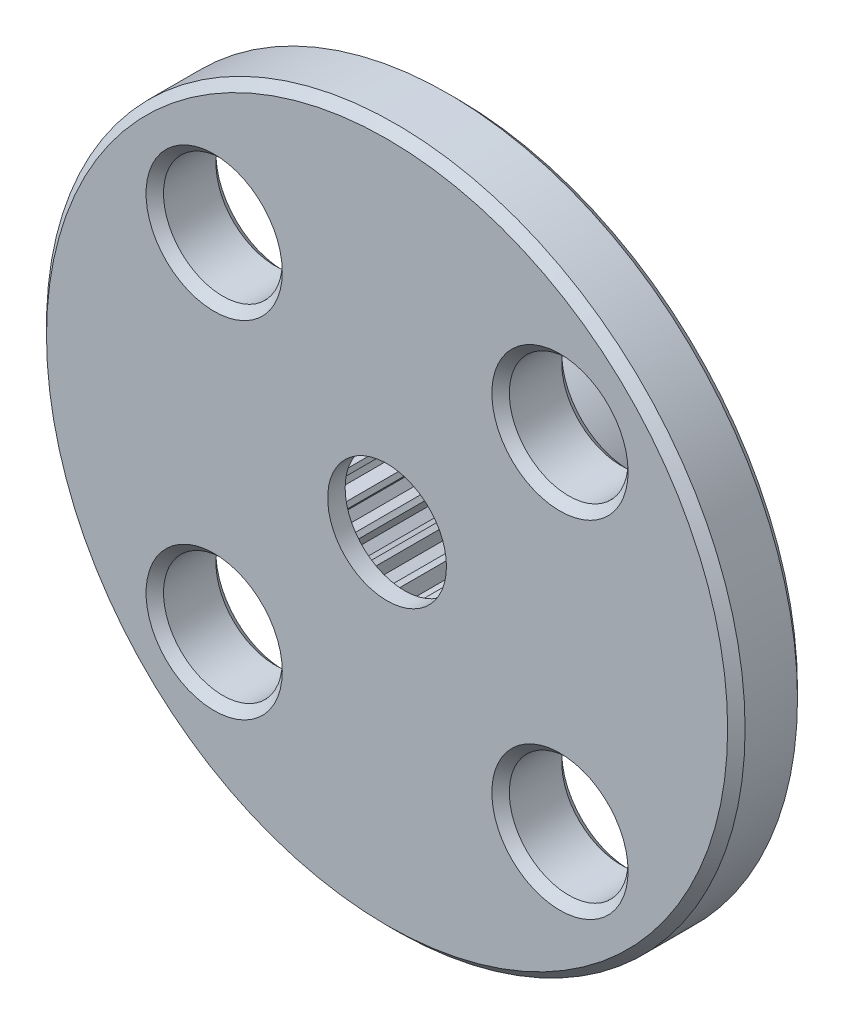
from build123d import *

# Parameters (mm, degrees)
CUT_EXTRUDE1_START             = -4
CUT_EXTRUDE1_OUTLINE_R         = 10
CUT_EXTRUDE1_DEPTH             = 2
CUT_EXTRUDE1_START_2           = -2
CUT_EXTRUDE1_2_OUTLINE_R       = 4.5
CUT_EXTRUDE1_2_DEPTH           = 2.5
CUT_EXTRUDE1_3_DEPTH           = 0.5
CUT_EXTRUDE1_START_3           = 0.42219887
CUT_EXTRUDE1_4_DEPTH           = 0.07780113
F_3_4_3_4_DIAMETER_HOLE1_D     = 3.4
F_3_4_3_4_DIAMETER_HOLE1_DEPTH = 4.5
F_3_4_3_4_DIAMETER_HOLE2_D     = 3.4
CHAMFER1_SIZE                  = 0.25


with BuildPart() as part:
    # Cut-Extrude1: read off the stored shape, not the designer's step
    # Cut-Extrude1 outline → Cut-Extrude1 (new body)
    with BuildSketch(Plane(origin=(0, 0, -2), x_dir=(-1, 0, 0), z_dir=(0, 0, -1)).offset(CUT_EXTRUDE1_START)):
        Circle(CUT_EXTRUDE1_OUTLINE_R)
        with BuildLine():
            Line((-2.618580344, -1.504944317), (-2.318244763, -1.172831706))
            ThreePointArc((-2.318244763, -1.172831706), (-2.350773593, -1.106190086), (-2.381387187, -1.038647225))
            Line((-2.381387187, -1.038647225), (-2.828725458, -1.058363222))
            Line((-2.828725458, -1.058363222), (-2.91057726, -0.806449273))
            Line((-2.91057726, -0.806449273), (-2.537084225, -0.559461013))
            ThreePointArc((-2.537084225, -0.559461013), (-2.552018005, -0.486823471), (-2.56487259, -0.413789301))
            Line((-2.56487259, -0.413789301), (-3.003060075, -0.32163738))
            Line((-3.003060075, -0.32163738), (-3.019691902, -0.057282056))
            Line((-3.019691902, -0.057282056), (-2.596509355, 0.089062673))
            ThreePointArc((-2.596509355, 0.089062673), (-2.592909741, 0.163132053), (-2.587197616, 0.237068526))
            Line((-2.587197616, 0.237068526), (-2.988701384, 0.435298121))
            Line((-2.988701384, 0.435298121), (-2.939068196, 0.695484403))
            Line((-2.939068196, 0.695484403), (-2.492786253, 0.731990224))
            ThreePointArc((-2.492786253, 0.731990224), (-2.470879421, 0.802837391), (-2.446959501, 0.873030465))
            Line((-2.446959501, 0.873030465), (-2.786551594, 1.16488224))
            Line((-2.786551594, 1.16488224), (-2.673772027, 1.40455102))
            Line((-2.673772027, 1.40455102), (-2.232432223, 1.328924137))
            ThreePointArc((-2.232432223, 1.328924137), (-2.19359466, 1.392097502), (-2.15296992, 1.45413669))
            Line((-2.15296992, 1.45413669), (-2.409312519, 1.821272524))
            Line((-2.409312519, 1.821272524), (-2.240472927, 2.02536453))
            Line((-2.240472927, 2.02536453), (-1.831806265, 1.842356859))
            ThreePointArc((-1.831806265, 1.842356859), (-1.77847828, 1.893887008), (-1.723701322, 1.943874158))
            Line((-1.723701322, 1.943874158), (-1.880687477, 2.363225557))
            Line((-1.880687477, 2.363225557), (-1.666396674, 2.518916939))
            Line((-1.666396674, 2.518916939), (-1.316081184, 2.240027524))
            ThreePointArc((-1.316081184, 2.240027524), (-1.251613568, 2.276676628), (-1.18612623, 2.311470864))
            Line((-1.18612623, 2.311470864), (-1.233891925, 2.756688437))
            Line((-1.233891925, 2.756688437), (-0.987614589, 2.854196532))
            Line((-0.987614589, 2.854196532), (-0.717661881, 2.496949021))
            ThreePointArc((-0.717661881, 2.496949021), (-0.646105372, 2.516414282), (-0.574022465, 2.533829355))
            Line((-0.574022465, 2.533829355), (-0.509566405, 2.976938444))
            Line((-0.509566405, 2.976938444), (-0.246777047, 3.01013646))
            Line((-0.246777047, 3.01013646), (-0.074149243, 2.596978029))
            ThreePointArc((-0.074149243, 2.596978029), (0, 2.598036372), (0.074149243, 2.596978029))
            Line((0.074149243, 2.596978029), (0.246777047, 3.01013646))
            Line((0.246777047, 3.01013646), (0.509566405, 2.976938444))
            Line((0.509566405, 2.976938444), (0.574022465, 2.533829355))
            ThreePointArc((0.574022465, 2.533829355), (0.646105372, 2.516414282), (0.717661881, 2.496949021))
            Line((0.717661881, 2.496949021), (0.987614589, 2.854196532))
            Line((0.987614589, 2.854196532), (1.233891925, 2.756688437))
            Line((1.233891925, 2.756688437), (1.18612623, 2.311470864))
            ThreePointArc((1.18612623, 2.311470864), (1.251613568, 2.276676628), (1.316081184, 2.240027524))
            Line((1.316081184, 2.240027524), (1.666396674, 2.518916939))
            Line((1.666396674, 2.518916939), (1.880687477, 2.363225557))
            Line((1.880687477, 2.363225557), (1.723701322, 1.943874158))
            ThreePointArc((1.723701322, 1.943874158), (1.77847828, 1.893887008), (1.831806265, 1.842356859))
            Line((1.831806265, 1.842356859), (2.240472927, 2.02536453))
            Line((2.240472927, 2.02536453), (2.409312519, 1.821272524))
            Line((2.409312519, 1.821272524), (2.15296992, 1.45413669))
            ThreePointArc((2.15296992, 1.45413669), (2.19359466, 1.392097502), (2.232432223, 1.328924137))
            Line((2.232432223, 1.328924137), (2.673772027, 1.40455102))
            Line((2.673772027, 1.40455102), (2.786551594, 1.16488224))
            Line((2.786551594, 1.16488224), (2.446959501, 0.873030465))
            ThreePointArc((2.446959501, 0.873030465), (2.470879421, 0.802837391), (2.492786253, 0.731990224))
            Line((2.492786253, 0.731990224), (2.939068196, 0.695484403))
            Line((2.939068196, 0.695484403), (2.988701384, 0.435298121))
            Line((2.988701384, 0.435298121), (2.587197616, 0.237068526))
            ThreePointArc((2.587197616, 0.237068526), (2.592909741, 0.163132054), (2.596509355, 0.089062674))
            Line((2.596509355, 0.089062674), (3.019691902, -0.057282056))
            Line((3.019691902, -0.057282056), (3.003060075, -0.32163738))
            Line((3.003060075, -0.32163738), (2.56487259, -0.413789301))
            ThreePointArc((2.56487259, -0.413789301), (2.552018005, -0.486823471), (2.537084225, -0.559461013))
            Line((2.537084225, -0.559461013), (2.91057726, -0.806449274))
            Line((2.91057726, -0.806449274), (2.828725457, -1.058363222))
            Line((2.828725457, -1.058363222), (2.381387187, -1.038647225))
            ThreePointArc((2.381387187, -1.038647225), (2.350773593, -1.106190086), (2.318244763, -1.172831706))
            Line((2.318244763, -1.172831706), (2.618580344, -1.504944317))
            Line((2.618580344, -1.504944317), (2.476651615, -1.728588209))
            Line((2.476651615, -1.728588209), (2.048270468, -1.598243123))
            ThreePointArc((2.048270468, -1.598243123), (2.00182143, -1.65605071), (1.953741456, -1.71250907))
            Line((1.953741456, -1.71250907), (2.162048395, -2.108878174))
            Line((2.162048395, -2.108878174), (1.968960643, -2.290199643))
            Line((1.968960643, -2.290199643), (1.586453383, -2.057415528))
            ThreePointArc((1.586453383, -2.057415528), (1.527087464, -2.101855577), (1.466477388, -2.14458319))
            Line((1.466477388, -2.14458319), (1.569666994, -2.58030346))
            Line((1.569666994, -2.58030346), (1.337552633, -2.70790941))
            Line((1.337552633, -2.70790941), (1.024953597, -2.387312949))
            ThreePointArc((1.024953597, -2.387312949), (0.956400977, -2.415593128), (0.887069153, -2.441905262))
            Line((0.887069153, -2.441905262), (0.878657643, -2.88959879))
            Line((0.878657643, -2.88959879), (0.622101272, -2.95547127))
            Line((0.622101272, -2.95547127), (0.399052208, -2.567206717))
            ThreePointArc((0.399052208, -2.567206717), (0.3256203, -2.577550079), (0.2519231, -2.585793445))
            Line((0.2519231, -2.585793445), (0.132439, -3.01733))
            Line((0.132439, -3.01733), (-0.132439, -3.01733))
            Line((-0.132439, -3.01733), (-0.2519231, -2.585793445))
            ThreePointArc((-0.2519231, -2.585793445), (-0.3256203, -2.577550079), (-0.399052208, -2.567206717))
            Line((-0.399052208, -2.567206717), (-0.622101272, -2.95547127))
            Line((-0.622101272, -2.95547127), (-0.878657643, -2.88959879))
            Line((-0.878657643, -2.88959879), (-0.887069153, -2.441905262))
            ThreePointArc((-0.887069153, -2.441905262), (-0.956400977, -2.415593128), (-1.024953597, -2.387312949))
            Line((-1.024953597, -2.387312949), (-1.337552633, -2.70790941))
            Line((-1.337552633, -2.70790941), (-1.569666994, -2.58030346))
            Line((-1.569666994, -2.58030346), (-1.466477388, -2.14458319))
            ThreePointArc((-1.466477388, -2.14458319), (-1.527087464, -2.101855577), (-1.586453383, -2.057415528))
            Line((-1.586453383, -2.057415528), (-1.968960643, -2.290199643))
            Line((-1.968960643, -2.290199643), (-2.162048395, -2.108878174))
            Line((-2.162048395, -2.108878174), (-1.953741456, -1.71250907))
            ThreePointArc((-1.953741456, -1.71250907), (-2.00182143, -1.65605071), (-2.048270468, -1.598243123))
            Line((-2.048270468, -1.598243123), (-2.476651616, -1.72858821))
            Line((-2.476651616, -1.72858821), (-2.618580344, -1.504944317))
        make_face(mode=Mode.SUBTRACT)
    extrude(amount=CUT_EXTRUDE1_DEPTH)

    # Cut-Extrude1 2 outline → Cut-Extrude1 2 (add)
    with BuildSketch(Plane(origin=(0, 0, -2), x_dir=(-1, 0, 0), z_dir=(0, 0, -1)).offset(CUT_EXTRUDE1_START_2)):
        Circle(CUT_EXTRUDE1_2_OUTLINE_R)
        with BuildLine():
            Line((-2.618580344, -1.504944317), (-2.318244763, -1.172831706))
            ThreePointArc((-2.318244763, -1.172831706), (-2.350773593, -1.106190086), (-2.381387187, -1.038647225))
            Line((-2.381387187, -1.038647225), (-2.828725458, -1.058363222))
            Line((-2.828725458, -1.058363222), (-2.91057726, -0.806449273))
            Line((-2.91057726, -0.806449273), (-2.537084225, -0.559461013))
            ThreePointArc((-2.537084225, -0.559461013), (-2.552018005, -0.486823471), (-2.56487259, -0.413789301))
            Line((-2.56487259, -0.413789301), (-3.003060075, -0.32163738))
            Line((-3.003060075, -0.32163738), (-3.019691902, -0.057282056))
            Line((-3.019691902, -0.057282056), (-2.596509355, 0.089062673))
            ThreePointArc((-2.596509355, 0.089062673), (-2.592909741, 0.163132053), (-2.587197616, 0.237068526))
            Line((-2.587197616, 0.237068526), (-2.988701384, 0.435298121))
            Line((-2.988701384, 0.435298121), (-2.939068196, 0.695484403))
            Line((-2.939068196, 0.695484403), (-2.492786253, 0.731990224))
            ThreePointArc((-2.492786253, 0.731990224), (-2.470879421, 0.802837391), (-2.446959501, 0.873030465))
            Line((-2.446959501, 0.873030465), (-2.786551594, 1.16488224))
            Line((-2.786551594, 1.16488224), (-2.673772027, 1.40455102))
            Line((-2.673772027, 1.40455102), (-2.232432223, 1.328924137))
            ThreePointArc((-2.232432223, 1.328924137), (-2.19359466, 1.392097502), (-2.15296992, 1.45413669))
            Line((-2.15296992, 1.45413669), (-2.409312519, 1.821272524))
            Line((-2.409312519, 1.821272524), (-2.240472927, 2.02536453))
            Line((-2.240472927, 2.02536453), (-1.831806265, 1.842356859))
            ThreePointArc((-1.831806265, 1.842356859), (-1.77847828, 1.893887008), (-1.723701322, 1.943874158))
            Line((-1.723701322, 1.943874158), (-1.880687477, 2.363225557))
            Line((-1.880687477, 2.363225557), (-1.666396674, 2.518916939))
            Line((-1.666396674, 2.518916939), (-1.316081184, 2.240027524))
            ThreePointArc((-1.316081184, 2.240027524), (-1.251613568, 2.276676628), (-1.18612623, 2.311470864))
            Line((-1.18612623, 2.311470864), (-1.233891925, 2.756688437))
            Line((-1.233891925, 2.756688437), (-0.987614589, 2.854196532))
            Line((-0.987614589, 2.854196532), (-0.717661881, 2.496949021))
            ThreePointArc((-0.717661881, 2.496949021), (-0.646105372, 2.516414282), (-0.574022465, 2.533829355))
            Line((-0.574022465, 2.533829355), (-0.509566405, 2.976938444))
            Line((-0.509566405, 2.976938444), (-0.246777047, 3.01013646))
            Line((-0.246777047, 3.01013646), (-0.074149243, 2.596978029))
            ThreePointArc((-0.074149243, 2.596978029), (0, 2.598036372), (0.074149243, 2.596978029))
            Line((0.074149243, 2.596978029), (0.246777047, 3.01013646))
            Line((0.246777047, 3.01013646), (0.509566405, 2.976938444))
            Line((0.509566405, 2.976938444), (0.574022465, 2.533829355))
            ThreePointArc((0.574022465, 2.533829355), (0.646105372, 2.516414282), (0.717661881, 2.496949021))
            Line((0.717661881, 2.496949021), (0.987614589, 2.854196532))
            Line((0.987614589, 2.854196532), (1.233891925, 2.756688437))
            Line((1.233891925, 2.756688437), (1.18612623, 2.311470864))
            ThreePointArc((1.18612623, 2.311470864), (1.251613568, 2.276676628), (1.316081184, 2.240027524))
            Line((1.316081184, 2.240027524), (1.666396674, 2.518916939))
            Line((1.666396674, 2.518916939), (1.880687477, 2.363225557))
            Line((1.880687477, 2.363225557), (1.723701322, 1.943874158))
            ThreePointArc((1.723701322, 1.943874158), (1.77847828, 1.893887008), (1.831806265, 1.842356859))
            Line((1.831806265, 1.842356859), (2.240472927, 2.02536453))
            Line((2.240472927, 2.02536453), (2.409312519, 1.821272524))
            Line((2.409312519, 1.821272524), (2.15296992, 1.45413669))
            ThreePointArc((2.15296992, 1.45413669), (2.19359466, 1.392097502), (2.232432223, 1.328924137))
            Line((2.232432223, 1.328924137), (2.673772027, 1.40455102))
            Line((2.673772027, 1.40455102), (2.786551594, 1.16488224))
            Line((2.786551594, 1.16488224), (2.446959501, 0.873030465))
            ThreePointArc((2.446959501, 0.873030465), (2.470879421, 0.802837391), (2.492786253, 0.731990224))
            Line((2.492786253, 0.731990224), (2.939068196, 0.695484403))
            Line((2.939068196, 0.695484403), (2.988701384, 0.435298121))
            Line((2.988701384, 0.435298121), (2.587197616, 0.237068526))
            ThreePointArc((2.587197616, 0.237068526), (2.592909741, 0.163132054), (2.596509355, 0.089062674))
            Line((2.596509355, 0.089062674), (3.019691902, -0.057282056))
            Line((3.019691902, -0.057282056), (3.003060075, -0.32163738))
            Line((3.003060075, -0.32163738), (2.56487259, -0.413789301))
            ThreePointArc((2.56487259, -0.413789301), (2.552018005, -0.486823471), (2.537084225, -0.559461013))
            Line((2.537084225, -0.559461013), (2.91057726, -0.806449274))
            Line((2.91057726, -0.806449274), (2.828725457, -1.058363222))
            Line((2.828725457, -1.058363222), (2.381387187, -1.038647225))
            ThreePointArc((2.381387187, -1.038647225), (2.350773593, -1.106190086), (2.318244763, -1.172831706))
            Line((2.318244763, -1.172831706), (2.618580344, -1.504944317))
            Line((2.618580344, -1.504944317), (2.476651615, -1.728588209))
            Line((2.476651615, -1.728588209), (2.048270468, -1.598243123))
            ThreePointArc((2.048270468, -1.598243123), (2.00182143, -1.65605071), (1.953741456, -1.71250907))
            Line((1.953741456, -1.71250907), (2.162048395, -2.108878174))
            Line((2.162048395, -2.108878174), (1.968960643, -2.290199643))
            Line((1.968960643, -2.290199643), (1.586453383, -2.057415528))
            ThreePointArc((1.586453383, -2.057415528), (1.527087464, -2.101855577), (1.466477388, -2.14458319))
            Line((1.466477388, -2.14458319), (1.569666994, -2.58030346))
            Line((1.569666994, -2.58030346), (1.337552633, -2.70790941))
            Line((1.337552633, -2.70790941), (1.024953597, -2.387312949))
            ThreePointArc((1.024953597, -2.387312949), (0.956400977, -2.415593128), (0.887069153, -2.441905262))
            Line((0.887069153, -2.441905262), (0.878657643, -2.88959879))
            Line((0.878657643, -2.88959879), (0.622101272, -2.95547127))
            Line((0.622101272, -2.95547127), (0.399052208, -2.567206717))
            ThreePointArc((0.399052208, -2.567206717), (0.3256203, -2.577550079), (0.2519231, -2.585793445))
            Line((0.2519231, -2.585793445), (0.132439, -3.01733))
            Line((0.132439, -3.01733), (-0.132439, -3.01733))
            Line((-0.132439, -3.01733), (-0.2519231, -2.585793445))
            ThreePointArc((-0.2519231, -2.585793445), (-0.3256203, -2.577550079), (-0.399052208, -2.567206717))
            Line((-0.399052208, -2.567206717), (-0.622101272, -2.95547127))
            Line((-0.622101272, -2.95547127), (-0.878657643, -2.88959879))
            Line((-0.878657643, -2.88959879), (-0.887069153, -2.441905262))
            ThreePointArc((-0.887069153, -2.441905262), (-0.956400977, -2.415593128), (-1.024953597, -2.387312949))
            Line((-1.024953597, -2.387312949), (-1.337552633, -2.70790941))
            Line((-1.337552633, -2.70790941), (-1.569666994, -2.58030346))
            Line((-1.569666994, -2.58030346), (-1.466477388, -2.14458319))
            ThreePointArc((-1.466477388, -2.14458319), (-1.527087464, -2.101855577), (-1.586453383, -2.057415528))
            Line((-1.586453383, -2.057415528), (-1.968960643, -2.290199643))
            Line((-1.968960643, -2.290199643), (-2.162048395, -2.108878174))
            Line((-2.162048395, -2.108878174), (-1.953741456, -1.71250907))
            ThreePointArc((-1.953741456, -1.71250907), (-2.00182143, -1.65605071), (-2.048270468, -1.598243123))
            Line((-2.048270468, -1.598243123), (-2.476651616, -1.72858821))
            Line((-2.476651616, -1.72858821), (-2.618580344, -1.504944317))
        make_face(mode=Mode.SUBTRACT)
    extrude(amount=CUT_EXTRUDE1_2_DEPTH)

    # Cut-Extrude1 3 outline → Cut-Extrude1 3 (add)
    with BuildSketch(Plane(origin=(0, 0, -2), x_dir=(-1, 0, 0), z_dir=(0, 0, -1)).offset(CUT_EXTRUDE1_START)):
        with BuildLine():
            ThreePointArc((-2.381387187, -1.038647225), (-2.350773593, -1.106190086), (-2.318244763, -1.172831706))
            Line((-2.318244763, -1.172831706), (-2.618580344, -1.504944317))
            Line((-2.618580344, -1.504944317), (-2.476651615, -1.728588209))
            Line((-2.476651615, -1.728588209), (-2.048270468, -1.598243123))
            ThreePointArc((-2.048270468, -1.598243123), (-2.00182143, -1.65605071), (-1.953741456, -1.71250907))
            Line((-1.953741456, -1.71250907), (-2.162048395, -2.108878175))
            Line((-2.162048395, -2.108878175), (-1.968960643, -2.290199643))
            Line((-1.968960643, -2.290199643), (-1.586453383, -2.057415528))
            ThreePointArc((-1.586453383, -2.057415528), (-1.527087464, -2.101855577), (-1.466477388, -2.14458319))
            Line((-1.466477388, -2.14458319), (-1.569666994, -2.58030346))
            Line((-1.569666994, -2.58030346), (-1.337552633, -2.70790941))
            Line((-1.337552633, -2.70790941), (-1.024953597, -2.387312949))
            ThreePointArc((-1.024953597, -2.387312949), (-0.956400977, -2.415593128), (-0.887069153, -2.441905262))
            Line((-0.887069153, -2.441905262), (-0.878657643, -2.88959879))
            Line((-0.878657643, -2.88959879), (-0.622101272, -2.95547127))
            Line((-0.622101272, -2.95547127), (-0.399052208, -2.567206717))
            ThreePointArc((-0.399052208, -2.567206717), (-0.3256203, -2.577550079), (-0.2519231, -2.585793445))
            Line((-0.2519231, -2.585793445), (-0.132439, -3.01733))
            Line((-0.132439, -3.01733), (0.132439, -3.01733))
            Line((0.132439, -3.01733), (0.2519231, -2.585793445))
            ThreePointArc((0.2519231, -2.585793445), (0.3256203, -2.577550079), (0.399052208, -2.567206717))
            Line((0.399052208, -2.567206717), (0.622101272, -2.95547127))
            Line((0.622101272, -2.95547127), (0.878657643, -2.88959879))
            Line((0.878657643, -2.88959879), (0.887069153, -2.441905262))
            ThreePointArc((0.887069153, -2.441905262), (0.956400977, -2.415593128), (1.024953597, -2.387312949))
            Line((1.024953597, -2.387312949), (1.337552633, -2.70790941))
            Line((1.337552633, -2.70790941), (1.569666994, -2.58030346))
            Line((1.569666994, -2.58030346), (1.466477388, -2.14458319))
            ThreePointArc((1.466477388, -2.14458319), (1.527087464, -2.101855577), (1.586453383, -2.057415528))
            Line((1.586453383, -2.057415528), (1.968960643, -2.290199643))
            Line((1.968960643, -2.290199643), (2.162048395, -2.108878174))
            Line((2.162048395, -2.108878174), (1.953741456, -1.71250907))
            ThreePointArc((1.953741456, -1.71250907), (2.00182143, -1.65605071), (2.048270468, -1.598243123))
            Line((2.048270468, -1.598243123), (2.476651615, -1.728588209))
            Line((2.476651615, -1.728588209), (2.618580344, -1.504944317))
            Line((2.618580344, -1.504944317), (2.318244763, -1.172831706))
            ThreePointArc((2.318244763, -1.172831706), (2.350773593, -1.106190086), (2.381387187, -1.038647225))
            Line((2.381387187, -1.038647225), (2.828725457, -1.058363222))
            Line((2.828725457, -1.058363222), (2.91057726, -0.806449274))
            Line((2.91057726, -0.806449274), (2.537084225, -0.559461013))
            ThreePointArc((2.537084225, -0.559461013), (2.552018005, -0.486823471), (2.56487259, -0.413789301))
            Line((2.56487259, -0.413789301), (3.003060075, -0.32163738))
            Line((3.003060075, -0.32163738), (3.019691902, -0.057282056))
            Line((3.019691902, -0.057282056), (2.596509355, 0.089062674))
            ThreePointArc((2.596509355, 0.089062674), (2.592909741, 0.163132054), (2.587197616, 0.237068526))
            Line((2.587197616, 0.237068526), (2.988701384, 0.435298121))
            Line((2.988701384, 0.435298121), (2.939068196, 0.695484403))
            Line((2.939068196, 0.695484403), (2.492786253, 0.731990224))
            ThreePointArc((2.492786253, 0.731990224), (2.470879421, 0.802837391), (2.446959501, 0.873030465))
            Line((2.446959501, 0.873030465), (2.786551594, 1.16488224))
            Line((2.786551594, 1.16488224), (2.673772027, 1.40455102))
            Line((2.673772027, 1.40455102), (2.232432223, 1.328924137))
            ThreePointArc((2.232432223, 1.328924137), (2.19359466, 1.392097502), (2.15296992, 1.45413669))
            Line((2.15296992, 1.45413669), (2.409312519, 1.821272524))
            Line((2.409312519, 1.821272524), (2.240472927, 2.02536453))
            Line((2.240472927, 2.02536453), (1.831806265, 1.842356859))
            ThreePointArc((1.831806265, 1.842356859), (1.77847828, 1.893887008), (1.723701322, 1.943874158))
            Line((1.723701322, 1.943874158), (1.880687477, 2.363225557))
            Line((1.880687477, 2.363225557), (1.666396674, 2.518916939))
            Line((1.666396674, 2.518916939), (1.316081184, 2.240027524))
            ThreePointArc((1.316081184, 2.240027524), (1.251613568, 2.276676628), (1.18612623, 2.311470864))
            Line((1.18612623, 2.311470864), (1.233891925, 2.756688437))
            Line((1.233891925, 2.756688437), (0.987614589, 2.854196532))
            Line((0.987614589, 2.854196532), (0.717661881, 2.496949021))
            ThreePointArc((0.717661881, 2.496949021), (0.646105372, 2.516414282), (0.574022465, 2.533829355))
            Line((0.574022465, 2.533829355), (0.509566405, 2.976938444))
            Line((0.509566405, 2.976938444), (0.246777047, 3.01013646))
            Line((0.246777047, 3.01013646), (0.074149243, 2.596978029))
            ThreePointArc((0.074149243, 2.596978029), (0, 2.598036372), (-0.074149243, 2.596978029))
            Line((-0.074149243, 2.596978029), (-0.246777047, 3.01013646))
            Line((-0.246777047, 3.01013646), (-0.509566405, 2.976938444))
            Line((-0.509566405, 2.976938444), (-0.574022465, 2.533829355))
            ThreePointArc((-0.574022465, 2.533829355), (-0.646105372, 2.516414282), (-0.717661881, 2.496949021))
            Line((-0.717661881, 2.496949021), (-0.987614589, 2.854196532))
            Line((-0.987614589, 2.854196532), (-1.233891925, 2.756688437))
            Line((-1.233891925, 2.756688437), (-1.18612623, 2.311470864))
            ThreePointArc((-1.18612623, 2.311470864), (-1.251613568, 2.276676628), (-1.316081184, 2.240027524))
            Line((-1.316081184, 2.240027524), (-1.666396674, 2.518916939))
            Line((-1.666396674, 2.518916939), (-1.880687477, 2.363225557))
            Line((-1.880687477, 2.363225557), (-1.723701322, 1.943874158))
            ThreePointArc((-1.723701322, 1.943874158), (-1.77847828, 1.893887008), (-1.831806265, 1.842356859))
            Line((-1.831806265, 1.842356859), (-2.240472927, 2.02536453))
            Line((-2.240472927, 2.02536453), (-2.409312519, 1.821272524))
            Line((-2.409312519, 1.821272524), (-2.15296992, 1.45413669))
            ThreePointArc((-2.15296992, 1.45413669), (-2.19359466, 1.392097502), (-2.232432223, 1.328924137))
            Line((-2.232432223, 1.328924137), (-2.673772027, 1.40455102))
            Line((-2.673772027, 1.40455102), (-2.786551594, 1.16488224))
            Line((-2.786551594, 1.16488224), (-2.446959501, 0.873030465))
            ThreePointArc((-2.446959501, 0.873030465), (-2.470879421, 0.802837391), (-2.492786253, 0.731990224))
            Line((-2.492786253, 0.731990224), (-2.939068196, 0.695484403))
            Line((-2.939068196, 0.695484403), (-2.988701384, 0.435298121))
            Line((-2.988701384, 0.435298121), (-2.587197616, 0.237068526))
            ThreePointArc((-2.587197616, 0.237068526), (-2.592909741, 0.163132053), (-2.596509355, 0.089062673))
            Line((-2.596509355, 0.089062673), (-3.019691902, -0.057282056))
            Line((-3.019691902, -0.057282056), (-3.003060075, -0.32163738))
            Line((-3.003060075, -0.32163738), (-2.56487259, -0.413789301))
            ThreePointArc((-2.56487259, -0.413789301), (-2.552018005, -0.486823471), (-2.537084225, -0.559461013))
            Line((-2.537084225, -0.559461013), (-2.91057726, -0.806449274))
            Line((-2.91057726, -0.806449274), (-2.828725457, -1.058363222))
            Line((-2.828725457, -1.058363222), (-2.381387187, -1.038647225))
        make_face()
    extrude(amount=CUT_EXTRUDE1_3_DEPTH)

    # Cut-Extrude1 4 outline → Cut-Extrude1 4 (add)
    with BuildSketch(Plane(origin=(0, 0, -2), x_dir=(-1, 0, 0), z_dir=(0, 0, -1)).offset(CUT_EXTRUDE1_START_3)):
        with BuildLine():
            ThreePointArc((-2.381387187, -1.038647225), (-2.350773593, -1.106190086), (-2.318244763, -1.172831706))
            Line((-2.318244763, -1.172831706), (-2.618580344, -1.504944317))
            Line((-2.618580344, -1.504944317), (-2.476651615, -1.728588209))
            Line((-2.476651615, -1.728588209), (-2.048270468, -1.598243123))
            ThreePointArc((-2.048270468, -1.598243123), (-2.00182143, -1.65605071), (-1.953741456, -1.71250907))
            Line((-1.953741456, -1.71250907), (-2.162048395, -2.108878175))
            Line((-2.162048395, -2.108878175), (-1.968960643, -2.290199643))
            Line((-1.968960643, -2.290199643), (-1.586453383, -2.057415528))
            ThreePointArc((-1.586453383, -2.057415528), (-1.527087464, -2.101855577), (-1.466477388, -2.14458319))
            Line((-1.466477388, -2.14458319), (-1.569666994, -2.58030346))
            Line((-1.569666994, -2.58030346), (-1.337552633, -2.70790941))
            Line((-1.337552633, -2.70790941), (-1.024953597, -2.387312949))
            ThreePointArc((-1.024953597, -2.387312949), (-0.956400977, -2.415593128), (-0.887069153, -2.441905262))
            Line((-0.887069153, -2.441905262), (-0.878657643, -2.88959879))
            Line((-0.878657643, -2.88959879), (-0.622101272, -2.95547127))
            Line((-0.622101272, -2.95547127), (-0.399052208, -2.567206717))
            ThreePointArc((-0.399052208, -2.567206717), (-0.3256203, -2.577550079), (-0.2519231, -2.585793445))
            Line((-0.2519231, -2.585793445), (-0.132439, -3.01733))
            Line((-0.132439, -3.01733), (0.132439, -3.01733))
            Line((0.132439, -3.01733), (0.2519231, -2.585793445))
            ThreePointArc((0.2519231, -2.585793445), (0.3256203, -2.577550079), (0.399052208, -2.567206717))
            Line((0.399052208, -2.567206717), (0.622101272, -2.95547127))
            Line((0.622101272, -2.95547127), (0.878657643, -2.88959879))
            Line((0.878657643, -2.88959879), (0.887069153, -2.441905262))
            ThreePointArc((0.887069153, -2.441905262), (0.956400977, -2.415593128), (1.024953597, -2.387312949))
            Line((1.024953597, -2.387312949), (1.337552633, -2.70790941))
            Line((1.337552633, -2.70790941), (1.569666994, -2.58030346))
            Line((1.569666994, -2.58030346), (1.466477388, -2.14458319))
            ThreePointArc((1.466477388, -2.14458319), (1.527087464, -2.101855577), (1.586453383, -2.057415528))
            Line((1.586453383, -2.057415528), (1.968960643, -2.290199643))
            Line((1.968960643, -2.290199643), (2.162048395, -2.108878174))
            Line((2.162048395, -2.108878174), (1.953741456, -1.71250907))
            ThreePointArc((1.953741456, -1.71250907), (2.00182143, -1.65605071), (2.048270468, -1.598243123))
            Line((2.048270468, -1.598243123), (2.476651615, -1.728588209))
            Line((2.476651615, -1.728588209), (2.618580344, -1.504944317))
            Line((2.618580344, -1.504944317), (2.318244763, -1.172831706))
            ThreePointArc((2.318244763, -1.172831706), (2.350773593, -1.106190086), (2.381387187, -1.038647225))
            Line((2.381387187, -1.038647225), (2.828725457, -1.058363222))
            Line((2.828725457, -1.058363222), (2.91057726, -0.806449274))
            Line((2.91057726, -0.806449274), (2.537084225, -0.559461013))
            ThreePointArc((2.537084225, -0.559461013), (2.552018005, -0.486823471), (2.56487259, -0.413789301))
            Line((2.56487259, -0.413789301), (3.003060075, -0.32163738))
            Line((3.003060075, -0.32163738), (3.019691902, -0.057282056))
            Line((3.019691902, -0.057282056), (2.596509355, 0.089062674))
            ThreePointArc((2.596509355, 0.089062674), (2.592909741, 0.163132054), (2.587197616, 0.237068526))
            Line((2.587197616, 0.237068526), (2.988701384, 0.435298121))
            Line((2.988701384, 0.435298121), (2.939068196, 0.695484403))
            Line((2.939068196, 0.695484403), (2.492786253, 0.731990224))
            ThreePointArc((2.492786253, 0.731990224), (2.470879421, 0.802837391), (2.446959501, 0.873030465))
            Line((2.446959501, 0.873030465), (2.786551594, 1.16488224))
            Line((2.786551594, 1.16488224), (2.673772027, 1.40455102))
            Line((2.673772027, 1.40455102), (2.232432223, 1.328924137))
            ThreePointArc((2.232432223, 1.328924137), (2.19359466, 1.392097502), (2.15296992, 1.45413669))
            Line((2.15296992, 1.45413669), (2.409312519, 1.821272524))
            Line((2.409312519, 1.821272524), (2.240472927, 2.02536453))
            Line((2.240472927, 2.02536453), (1.831806265, 1.842356859))
            ThreePointArc((1.831806265, 1.842356859), (1.77847828, 1.893887008), (1.723701322, 1.943874158))
            Line((1.723701322, 1.943874158), (1.880687477, 2.363225557))
            Line((1.880687477, 2.363225557), (1.666396674, 2.518916939))
            Line((1.666396674, 2.518916939), (1.316081184, 2.240027524))
            ThreePointArc((1.316081184, 2.240027524), (1.251613568, 2.276676628), (1.18612623, 2.311470864))
            Line((1.18612623, 2.311470864), (1.233891925, 2.756688437))
            Line((1.233891925, 2.756688437), (0.987614589, 2.854196532))
            Line((0.987614589, 2.854196532), (0.717661881, 2.496949021))
            ThreePointArc((0.717661881, 2.496949021), (0.646105372, 2.516414282), (0.574022465, 2.533829355))
            Line((0.574022465, 2.533829355), (0.509566405, 2.976938444))
            Line((0.509566405, 2.976938444), (0.246777047, 3.01013646))
            Line((0.246777047, 3.01013646), (0.074149243, 2.596978029))
            ThreePointArc((0.074149243, 2.596978029), (0, 2.598036372), (-0.074149243, 2.596978029))
            Line((-0.074149243, 2.596978029), (-0.246777047, 3.01013646))
            Line((-0.246777047, 3.01013646), (-0.509566405, 2.976938444))
            Line((-0.509566405, 2.976938444), (-0.574022465, 2.533829355))
            ThreePointArc((-0.574022465, 2.533829355), (-0.646105372, 2.516414282), (-0.717661881, 2.496949021))
            Line((-0.717661881, 2.496949021), (-0.987614589, 2.854196532))
            Line((-0.987614589, 2.854196532), (-1.233891925, 2.756688437))
            Line((-1.233891925, 2.756688437), (-1.18612623, 2.311470864))
            ThreePointArc((-1.18612623, 2.311470864), (-1.251613568, 2.276676628), (-1.316081184, 2.240027524))
            Line((-1.316081184, 2.240027524), (-1.666396674, 2.518916939))
            Line((-1.666396674, 2.518916939), (-1.880687477, 2.363225557))
            Line((-1.880687477, 2.363225557), (-1.723701322, 1.943874158))
            ThreePointArc((-1.723701322, 1.943874158), (-1.77847828, 1.893887008), (-1.831806265, 1.842356859))
            Line((-1.831806265, 1.842356859), (-2.240472927, 2.02536453))
            Line((-2.240472927, 2.02536453), (-2.409312519, 1.821272524))
            Line((-2.409312519, 1.821272524), (-2.15296992, 1.45413669))
            ThreePointArc((-2.15296992, 1.45413669), (-2.19359466, 1.392097502), (-2.232432223, 1.328924137))
            Line((-2.232432223, 1.328924137), (-2.673772027, 1.40455102))
            Line((-2.673772027, 1.40455102), (-2.786551594, 1.16488224))
            Line((-2.786551594, 1.16488224), (-2.446959501, 0.873030465))
            ThreePointArc((-2.446959501, 0.873030465), (-2.470879421, 0.802837391), (-2.492786253, 0.731990224))
            Line((-2.492786253, 0.731990224), (-2.939068196, 0.695484403))
            Line((-2.939068196, 0.695484403), (-2.988701384, 0.435298121))
            Line((-2.988701384, 0.435298121), (-2.587197616, 0.237068526))
            ThreePointArc((-2.587197616, 0.237068526), (-2.592909741, 0.163132053), (-2.596509355, 0.089062673))
            Line((-2.596509355, 0.089062673), (-3.019691902, -0.057282056))
            Line((-3.019691902, -0.057282056), (-3.003060075, -0.32163738))
            Line((-3.003060075, -0.32163738), (-2.56487259, -0.413789301))
            ThreePointArc((-2.56487259, -0.413789301), (-2.552018005, -0.486823471), (-2.537084225, -0.559461013))
            Line((-2.537084225, -0.559461013), (-2.91057726, -0.806449274))
            Line((-2.91057726, -0.806449274), (-2.828725457, -1.058363222))
            Line((-2.828725457, -1.058363222), (-2.381387187, -1.038647225))
        make_face()
    extrude(amount=CUT_EXTRUDE1_4_DEPTH)

    # Cut-Extrude1 5 outline → Cut-Extrude1 5 (revolve)
    with BuildSketch(Plane.XZ):
        Polygon((3.020235162, -2.42219879), (2.598036372, -2), (0, -2), (0, -2.42219887), align=None)
    revolve(axis=Axis((0, 0, 0), (0, 0, 1)))

    # Sketch2 → Cut-Revolve1 (revolve, cut)
    with BuildSketch(Plane(origin=(0, 0, 0), x_dir=(1, 0, 0), z_dir=(0, 1, 0))):
        Polygon((3.098036372, 2.5), (0, 2.5), (0, 2), (2.598036372, 2), align=None)
    revolve(axis=Axis((0, 0, -2.5), (0, 0, 1)), mode=Mode.SUBTRACT)

    # Ø3.4 (3.4) Diameter Hole1
    with Locations(Plane.XY.offset(2)):
        with Locations((0, 0)):
            Hole(F_3_4_3_4_DIAMETER_HOLE1_D / 2, depth=F_3_4_3_4_DIAMETER_HOLE1_DEPTH)

    # Ø3.4 (3.4) Diameter Hole2 (through all)
    with Locations(Plane(origin=(0, 0, 0), x_dir=(-1, 0, 0), z_dir=(0, 0, -1))):
        with Locations((4.949747468, -4.949747468), (4.949747468, 4.949747468), (-4.949747468, 4.949747468), (-4.949747468, -4.949747468)):
            Hole(F_3_4_3_4_DIAMETER_HOLE2_D / 2)

    # Chamfer1
    chamfer1_edges = [part.edges().sort_by_distance(p)[0] for p in [
        (3.249747468, -4.949747468, 0),
        (3.249747468, -4.949747468, 2),
        (3.249747468, 4.949747468, 0),
        (3.249747468, 4.949747468, 2),
        (-6.649747468, 4.949747468, 0),
        (-6.649747468, 4.949747468, 2),
        (-6.649747468, -4.949747468, 0),
        (-6.649747468, -4.949747468, 2),
        (10, 0, 2),
        (10, 0, 0),
        (4.5, 0, -2.5),
    ]]
    chamfer(chamfer1_edges, length=CHAMFER1_SIZE)


solid = part.part
